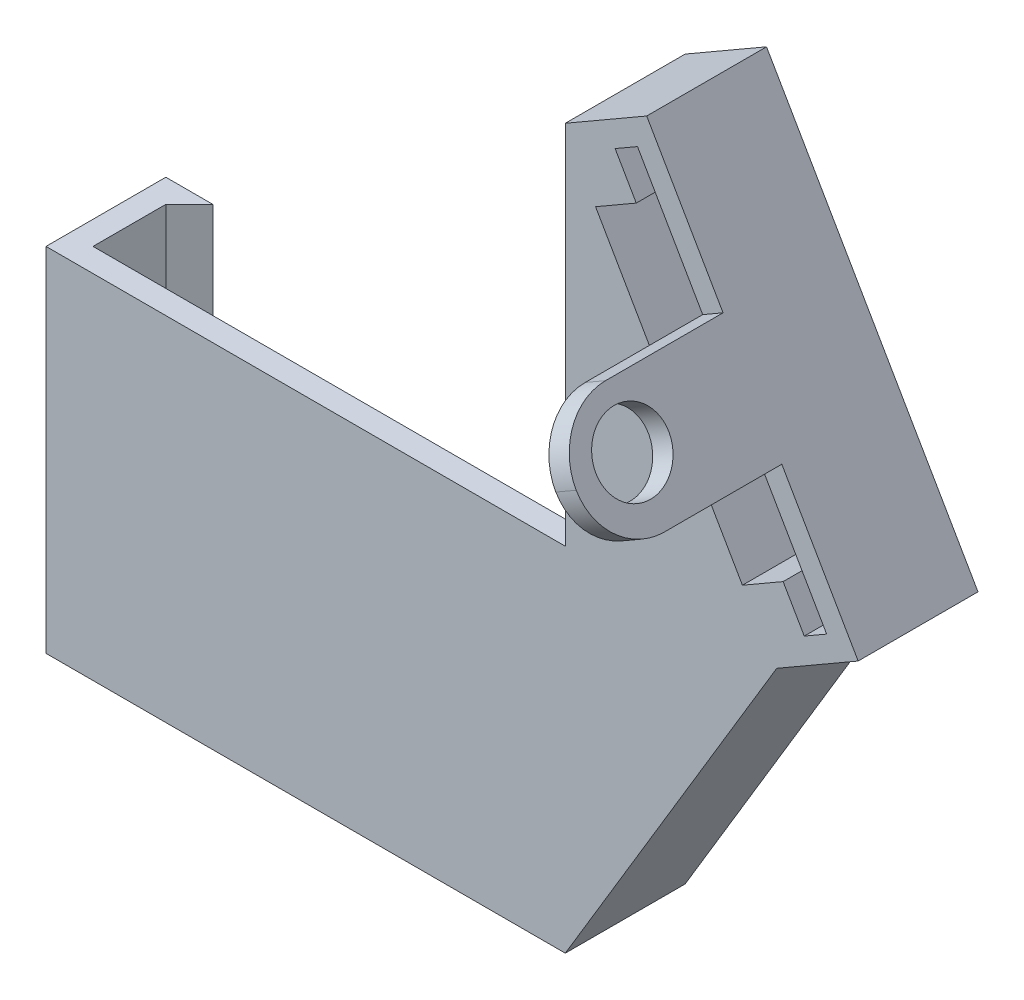
from build123d import *

# Parameters (mm, degrees)
BOSS_EXTRUDE1_DEPTH = 30
BOSS_EXTRUDE2_DEPTH = 10.2
CUT_EXTRUDE1_DEPTH  = 10.2
SKETCH4_W           = 15
SKETCH4_H           = 10
BOSS_EXTRUDE3_DEPTH = 2
FILLET1_R           = 5
CUT_EXTRUDE2_REACH  = 85.187
SKETCH5_R           = 3.1


with BuildPart() as part:
    # Sketch1 → Boss-Extrude1 (new body)
    with BuildSketch(Plane(origin=(0, 0, 0), x_dir=(1, 0, 0), z_dir=(0, 1, 0))):
        Polygon((18.1, 3.1), (18.1, 5.1), (22.1, 5.1), (22.1, -5.1), (-22.1, -5.1), (-22.1, 5.1), (-18.1, 5.1), (-20.1, 3.1), (-20.1, -3.1), (20.1, -3.1), (20.1, 3.1), align=None)
    extrude(amount=BOSS_EXTRUDE1_DEPTH)

    # Sketch2 → Boss-Extrude2 (add)
    with BuildSketch(Plane.XY.offset(5.1)):
        Polygon((47.02820323, 34), (29.02820323, 65.176914536), (22.1, 61.176914536), (22.1, 30), (22.1, 0), (40.1, 30), align=None)
    extrude(amount=-BOSS_EXTRUDE2_DEPTH)

    # Sketch3 → Cut-Extrude1 (cut)
    with BuildSketch(Plane.XY.offset(5.1)):
        Polygon((44.346152423, 34.645448267), (28.246152423, 62.531466269), (26.340896534, 61.431466269), (28.140896534, 58.313774815), (24.676794919, 56.313774815), (37.176794919, 34.663139721), (40.640896534, 36.663139721), (42.440896534, 33.545448267), align=None)
    extrude(amount=-CUT_EXTRUDE1_DEPTH, mode=Mode.SUBTRACT)

    # Sketch4 → Boss-Extrude3 (add)
    with BuildSketch(Plane(origin=(49.993584287, 28.863809346, 0), x_dir=(0, 0, -1), z_dir=(0.8660254037844421, 0.49999999999999406, 0))):
        with Locations((-12.6, 23.930762114)):
            Rectangle(SKETCH4_W, SKETCH4_H)
    extrude(amount=-BOSS_EXTRUDE3_DEPTH)

    # Fillet1
    fillet1_edges = [part.edges().sort_by_distance(p)[0] for p in [
        (34.662177826, 53.418584287, 20.1),
        (39.662177826, 44.758330249, 20.1),
    ]]
    fillet(fillet1_edges, radius=FILLET1_R - 0.0001)  # a hair under: the kernel refuses the full size

    # Sketch5 → Cut-Extrude2 (cut, up to next)
    with BuildSketch(Plane(origin=(49.993584287, 28.863809346, 0), x_dir=(0, 0, -1), z_dir=(0.8660254037844421, 0.49999999999999406, 0)), mode=Mode.PRIVATE) as cut_extrude2_sk1:
        with Locations(Location((-15.175304154, 24.225635186, 0), (0, 0, 90))):
            Circle(SKETCH5_R)
    cut_extrude2_tool1 = extrude(cut_extrude2_sk1.sketch, amount=-CUT_EXTRUDE2_REACH, mode=Mode.PRIVATE) & part.part
    add(cut_extrude2_tool1.solids().sort_by_distance((37.880767, 49.843825, 15.175304))[0], mode=Mode.SUBTRACT)


solid = part.part
